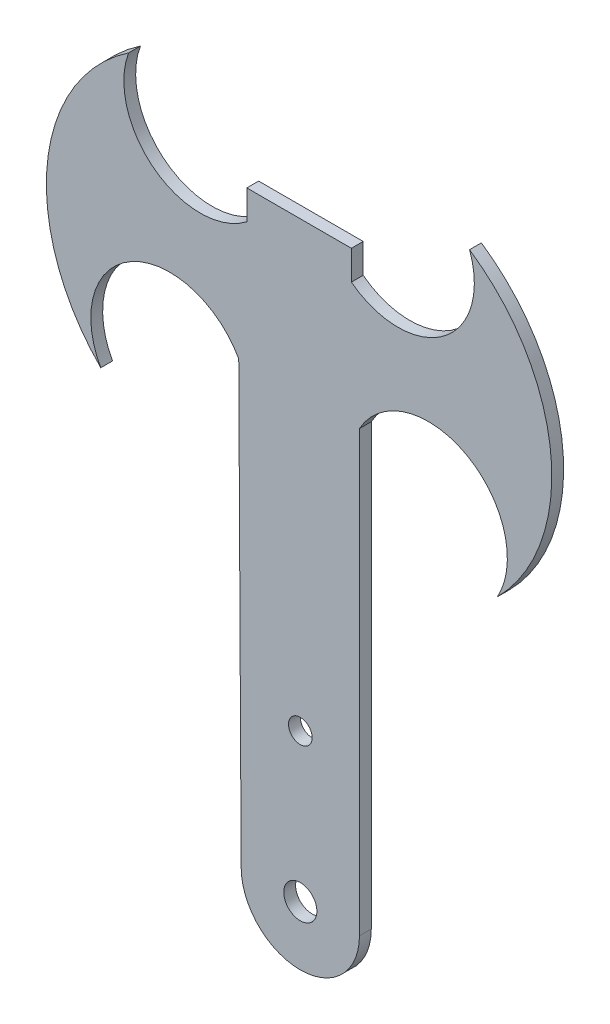
from build123d import *

# Parameters (mm, degrees)
MODEL_R           = 1.4
MODEL_R_2         = 1
BRIDA_BASE1_DEPTH = 1


# Sheet-metal steps are written as plain solids
with BuildPart() as part:
    # Model → Brida base1 (new body)
    with BuildSketch(Plane.XY):
        with BuildLine():
            Line((40, 21.38389001), (40.2059904, -15.761563617))
            ThreePointArc((40.2059904, -15.761563617), (45.205990408, -20.761561608), (50.205990416, -15.761563617))
            Line((50.205990416, -15.761563617), (50.205990416, 21.38389001))
            ThreePointArc((50.205990416, 21.38389001), (59.282249533, 23.973347274), (61.871706797, 14.897088157))
            ThreePointArc((61.871706797, 14.897088157), (66.397009574, 27.571280603), (59.516453931, 39.13724245))
            ThreePointArc((59.516453931, 39.13724245), (57.297457404, 31.686860899), (49.524022567, 31.763291841))
            Line((49.524022567, 31.763291841), (49.524022567, 34.243690175))
            Line((49.524022567, 34.243690175), (40.681967849, 34.243690175))
            Line((40.681967849, 34.243690175), (40.681967849, 31.763291841))
            ThreePointArc((40.681967849, 31.763291841), (32.908533012, 31.686860899), (30.689536484, 39.13724245))
            ThreePointArc((30.689536484, 39.13724245), (23.808980842, 27.571280603), (28.334283619, 14.897088157))
            ThreePointArc((28.334283619, 14.897088157), (30.923740883, 23.973347274), (40, 21.38389001))
        make_face()
        with Locations((45.205990408, -15.7615616)):
            Circle(MODEL_R, mode=Mode.SUBTRACT)
        with Locations((45.205990408, -3.2615616)):
            Circle(MODEL_R_2, mode=Mode.SUBTRACT)
    extrude(amount=-BRIDA_BASE1_DEPTH)


solid = part.part
